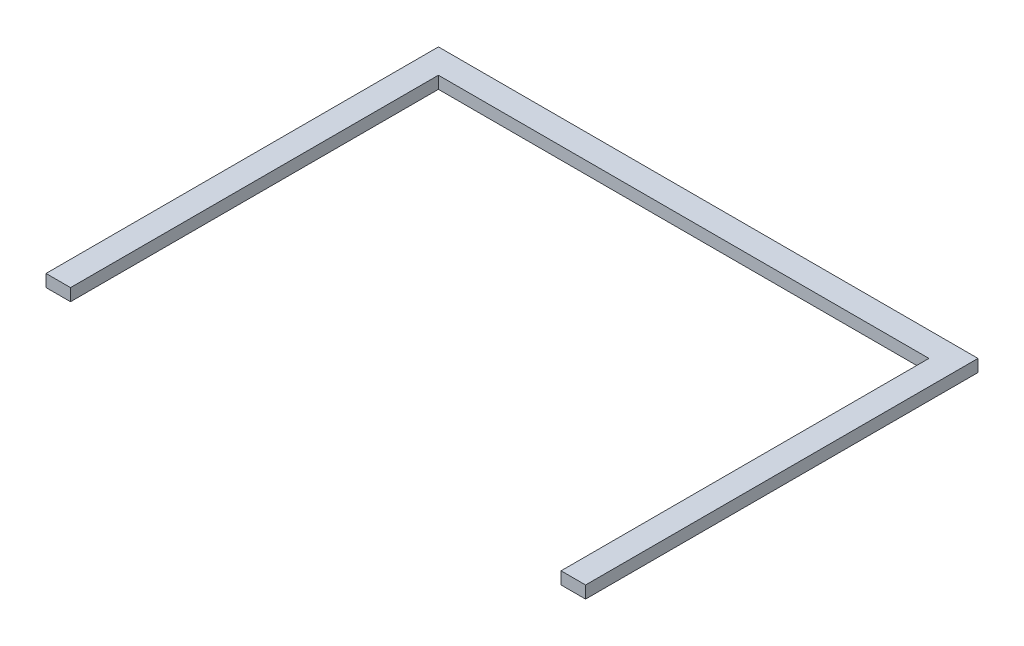
from build123d import *

# Parameters (mm, degrees)
BOSS_EXTRUDE1_DEPTH = 6.35


with BuildPart() as part:
    # Sketch1 → Boss-Extrude1 (new body)
    with BuildSketch(Plane(origin=(0, 0, 0), x_dir=(1, 0, 0), z_dir=(0, 1, 0))):
        Polygon((-127, -101.6), (-127, 88.9), (127, 88.9), (127, -101.6), (139.7, -101.6), (139.7, 101.6), (-139.7, 101.6), (-139.7, -101.6), align=None)
    extrude(amount=-BOSS_EXTRUDE1_DEPTH)


solid = part.part
